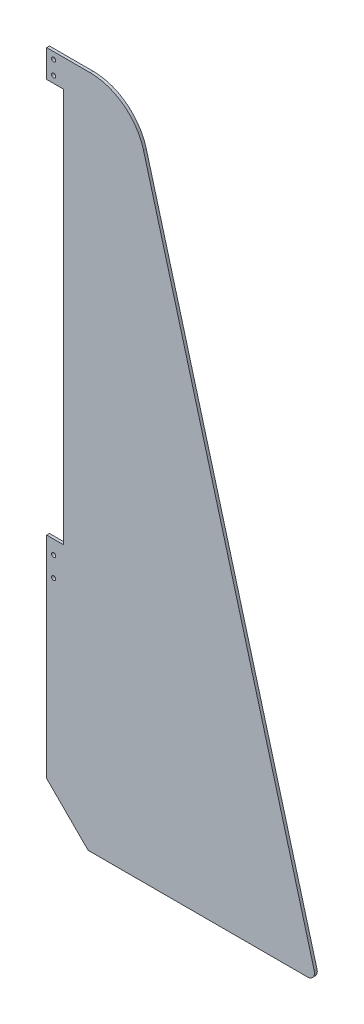
from build123d import *

# Parameters (mm, degrees)
BOSS_EXTRUDE1_DEPTH = 2
SKETCH6_R           = 1.5
CUT_EXTRUDE2_DEPTH  = 458.711731951


with BuildPart() as part:
    # Sketch2 → Boss-Extrude1 (new body)
    with BuildSketch(Plane.XY):
        with BuildLine():
            Line((0, -44.152234752), (0, 108.672910373))
            Line((0, 108.672910373), (12, 108.672910373))
            Line((12, 108.672910373), (12, 394.552718856))
            Line((12, 394.552718856), (0, 394.552718856))
            Line((0, 394.552718856), (0, 414.552718856))
            Line((0, 414.552718856), (31.571237908, 414.552718856))
            ThreePointArc((31.571237908, 414.552718856), (55.84589982, 406.344868658), (70.158422303, 385.08975831))
            Line((70.158422303, 385.08975831), (193.839049105, -67.83510482))
            ThreePointArc((193.839049105, -67.83510482), (192.989669781, -72.186567491), (189.015651056, -74.152234752))
            Line((189.015651056, -74.152234752), (30, -74.152234752))
            Line((30, -74.152234752), (0, -44.152234752))
        make_face()
    extrude(amount=BOSS_EXTRUDE1_DEPTH)

    # Sketch6 → Cut-Extrude2 (cut, through all)
    with BuildSketch(Plane.XY.offset(2)):
        with Locations((4.986839826, 98.672910373)):
            Circle(SKETCH6_R)
        with Locations((4.986839826, 84.172910373)):
            Circle(SKETCH6_R)
        with Locations((4.986839826, 399.552718856)):
            Circle(SKETCH6_R)
        with Locations((4.986839826, 409.552718856)):
            Circle(SKETCH6_R)
    extrude(amount=-CUT_EXTRUDE2_DEPTH, mode=Mode.SUBTRACT)


solid = part.part
